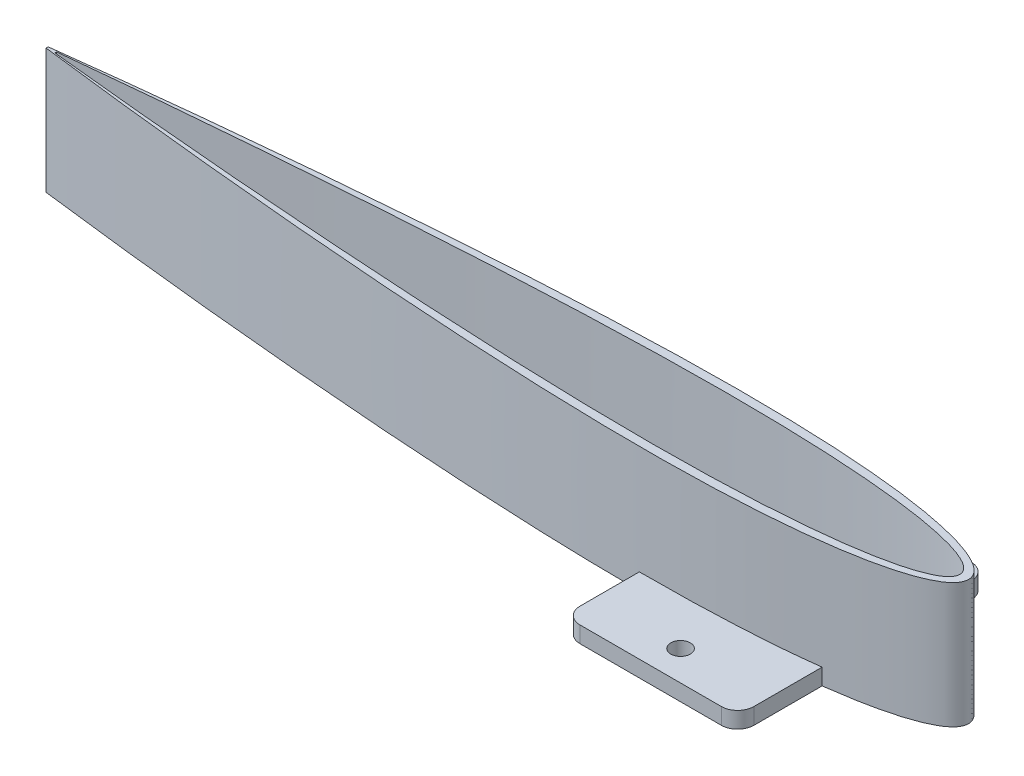
from build123d import *

# Parameters (mm, degrees)
BOSS_EXTRUDE1_DEPTH = 23
BOSS_EXTRUDE2_DEPTH = 3
CUT_EXTRUDE1_DEPTH  = 20
SKETCH4_R           = 1.8
CUT_EXTRUDE2_DEPTH  = 3


with BuildPart() as part:
    # Sketch1 → Boss-Extrude1 (new body)
    with BuildSketch(Plane(origin=(0, 0, 0), x_dir=(1, 0, 0), z_dir=(0, 1, 0))):
        with BuildLine():
            Line((-167.983, 0.190831935), (-167.983, -0.190831935))
            add(Edge.make_bspline(
                [(-167.983, 0.190831935), (-167.828169289, 0.21021337), (-167.210590512, 0.287520789), (-165.827390093, 0.459342531), (-163.538893659, 0.739955791), (-160.370135676, 1.120909439), (-156.355814896, 1.591405882), (-151.539889761, 2.138708376), (-145.975114132, 2.748871295), (-139.722455575, 3.407199818), (-132.850427662, 4.098572616), (-125.434334669, 4.807528752), (-117.555440893, 5.518170708), (-109.300073503, 6.21394799), (-100.75867003, 6.877430428), (-92.024781933, 7.490190091), (-83.194046341, 8.032901223), (-74.363138282, 8.485733666), (-65.628715037, 8.829063734), (-57.086363389, 9.044465116), (-48.829556525, 9.115883796), (-40.948630914, 9.030848954), (-33.529767822, 8.781561264), (-26.654035064, 8.365649258), (-20.396275791, 7.786595692), (-14.824447117, 7.053307513), (-9.997206672, 6.180257523), (-5.965712013, 5.183777436), (-2.759543385, 4.087127963), (-0.406172467, 2.893778413), (1.158585828, 1.604893192), (1.791004628, 0), (1.158585828, -1.604893192), (-0.406172467, -2.893778413), (-2.759543385, -4.087127963), (-5.965712013, -5.183777436), (-9.997206672, -6.180257523), (-14.824447117, -7.053307513), (-20.396275791, -7.786595692), (-26.654035064, -8.365649258), (-33.529767822, -8.781561264), (-40.948630914, -9.030848954), (-48.829556525, -9.115883796), (-57.086363389, -9.044465116), (-65.628715037, -8.829063734), (-74.363138282, -8.485733666), (-83.194046341, -8.032901223), (-92.024781933, -7.490190091), (-100.75867003, -6.877430428), (-109.300073503, -6.21394799), (-117.555440893, -5.518170708), (-125.434334669, -4.807528752), (-132.850427662, -4.098572616), (-139.722455575, -3.407199818), (-145.975114132, -2.748871295), (-151.539889761, -2.138708376), (-156.355814896, -1.591405882), (-160.370135676, -1.120909439), (-163.538893659, -0.739955791), (-165.827390093, -0.459342531), (-167.210590512, -0.287520789), (-167.828169289, -0.21021337), (-167.983, -0.190831935)],
                knots=[0, 0, 0, 0, 0.001358409, 0.005418335, 0.012134095, 0.021430279, 0.033202786, 0.0473202, 0.063625423, 0.081937539, 0.102053856, 0.123752122, 0.146792911, 0.170922201, 0.195874151, 0.221374098, 0.247141765, 0.272894669, 0.298351655, 0.323236503, 0.347281475, 0.370230714, 0.391843414, 0.411896782, 0.430188938, 0.446542139, 0.460807177, 0.472870789, 0.482670757, 0.490232532, 0.495773512, 0.5, 0.504226488, 0.509767468, 0.517329243, 0.527129211, 0.539192823, 0.553457861, 0.569811062, 0.588103218, 0.608156586, 0.629769286, 0.652718525, 0.676763497, 0.701648345, 0.727105331, 0.752858235, 0.778625902, 0.804125849, 0.829077799, 0.853207089, 0.876247878, 0.897946144, 0.918062461, 0.936374577, 0.9526798, 0.966797214, 0.978569721, 0.987865905, 0.994581665, 0.998641591, 1, 1, 1, 1], degree=3))
        make_face()
    extrude(amount=BOSS_EXTRUDE1_DEPTH)

    # Sketch2 → Boss-Extrude2 (add)
    with BuildSketch(Plane(origin=(0, 0, 0), x_dir=(1, 0, 0), z_dir=(0, 1, 0))):
        with BuildLine():
            Line((-46.9, -23), (-20.9, -23))
            ThreePointArc((-20.9, -23), (-18.778679656, -22.121320344), (-17.9, -20))
            Line((-17.9, -20), (-17.9, 20))
            ThreePointArc((-17.9, 20), (-18.778679656, 22.121320344), (-20.9, 23))
            Line((-20.9, 23), (-46.9, 23))
            ThreePointArc((-46.9, 23), (-49.021320344, 22.121320344), (-49.9, 20))
            Line((-49.9, 20), (-49.9, -20))
            ThreePointArc((-49.9, -20), (-49.021320344, -22.121320344), (-46.9, -23))
        make_face()
    extrude(amount=BOSS_EXTRUDE2_DEPTH)

    # Sketch3 → Cut-Extrude1 (cut)
    with BuildSketch(Plane(origin=(0, 23, 0), x_dir=(1, 0, 0), z_dir=(0, 1, 0))):
        with BuildLine():
            Line((-166.383, 0.157231935), (-166.383, -0.157231935))
            add(Edge.make_bspline(
                [(-166.383, 0.157231935), (-166.23109048, 0.173200904), (-165.625149912, 0.236898333), (-164.268013016, 0.378471068), (-162.022640503, 0.609682429), (-158.913606159, 0.923567879), (-154.974960109, 1.311230217), (-150.249838785, 1.762174439), (-144.790004371, 2.26490998), (-138.655275075, 2.807329288), (-131.912869935, 3.376973654), (-124.63666911, 3.961104633), (-116.906400519, 4.546623964), (-108.806761615, 5.119895133), (-100.42648679, 5.666556501), (-91.857371342, 6.171424044), (-83.193263491, 6.618573921), (-74.52903624, 6.991667038), (-65.95955036, 7.274535524), (-57.578619505, 7.451999704), (-49.477984587, 7.510838305), (-41.746310866, 7.440783141), (-34.468189507, 7.235431926), (-27.723221712, 6.892826255), (-21.58491619, 6.415974411), (-16.120219715, 5.811996617), (-11.386864514, 5.093947849), (-7.436523371, 4.27300729), (-4.298116285, 3.377389541), (-2.005220374, 2.394066023), (-0.477736378, 1.378168149), (0.197509288, 0), (-0.477736378, -1.378168149), (-2.005220374, -2.394066023), (-4.298116285, -3.377389541), (-7.436523371, -4.27300729), (-11.386864514, -5.093947849), (-16.120219715, -5.811996617), (-21.58491619, -6.415974411), (-27.723221712, -6.892826255), (-34.468189507, -7.235431926), (-41.746310866, -7.440783141), (-49.477984587, -7.510838305), (-57.578619505, -7.451999704), (-65.95955036, -7.274535524), (-74.52903624, -6.991667038), (-83.193263491, -6.618573921), (-91.857371342, -6.171424044), (-100.42648679, -5.666556501), (-108.806761615, -5.119895133), (-116.906400519, -4.546623964), (-124.63666911, -3.961104633), (-131.912869935, -3.376973654), (-138.655275075, -2.807329288), (-144.790004371, -2.26490998), (-150.249838785, -1.762174439), (-154.974960109, -1.311230217), (-158.913606159, -0.923567879), (-162.022640503, -0.609682429), (-164.268013016, -0.378471068), (-165.625149912, -0.236898333), (-166.23109048, -0.173200904), (-166.383, -0.157231935)],
                knots=[0, 0, 0, 0, 0.001360811, 0.005428038, 0.012156267, 0.021470482, 0.03326704, 0.047414968, 0.063757539, 0.082114088, 0.102282038, 0.12403911, 0.147145729, 0.171347612, 0.196378555, 0.221963406, 0.247821218, 0.273668571, 0.299222988, 0.324206394, 0.348348543, 0.371390297, 0.393086736, 0.413210068, 0.431552463, 0.44792908, 0.462181893, 0.474185722, 0.483860131, 0.491198837, 0.496361358, 0.5, 0.503638642, 0.508801163, 0.516139869, 0.525814278, 0.537818107, 0.55207092, 0.568447537, 0.586789932, 0.606913264, 0.628609703, 0.651651457, 0.675793606, 0.700777012, 0.726331429, 0.752178782, 0.778036594, 0.803621445, 0.828652388, 0.852854271, 0.87596089, 0.897717962, 0.917885912, 0.936242461, 0.952585032, 0.96673296, 0.978529518, 0.987843733, 0.994571962, 0.998639189, 1, 1, 1, 1], degree=3))
        make_face()
    extrude(amount=-CUT_EXTRUDE1_DEPTH, mode=Mode.SUBTRACT)

    # Sketch4 → Cut-Extrude2 (cut)
    with BuildSketch(Plane(origin=(0, 0, 0), x_dir=(1, 0, 0), z_dir=(0, 1, 0))):
        with Locations((-33.9, -17.5)):
            Circle(SKETCH4_R)
        with Locations((-33.9, 17.5)):
            Circle(SKETCH4_R)
    extrude(amount=CUT_EXTRUDE2_DEPTH, mode=Mode.SUBTRACT)


solid = part.part
